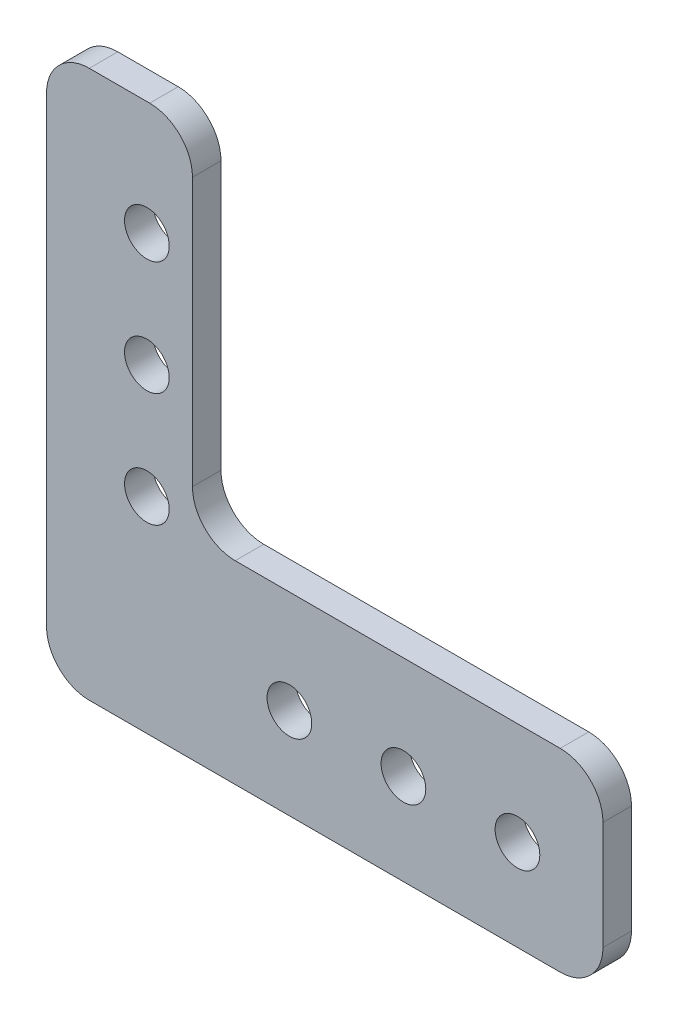
from build123d import *

# Parameters (mm, degrees)
SKETCH1_R           = 2.4892
BOSS_EXTRUDE1_DEPTH = 3.175
FILLET1_R           = 4.7625


with BuildPart() as part:
    # Sketch1 → Boss-Extrude1 (new body)
    with BuildSketch(Plane.XY):
        Polygon((-27.051, 31.75), (-27.051, -29.21), (34.925, -29.21), (34.925, -7.62), (-10.795, -7.62), (-10.795, 31.75), align=None)
        with Locations((-15.875, -6.35)):
            Circle(SKETCH1_R, mode=Mode.SUBTRACT)
        with Locations((0, -19.05)):
            Circle(SKETCH1_R, mode=Mode.SUBTRACT)
        with Locations((12.7, -19.05)):
            Circle(SKETCH1_R, mode=Mode.SUBTRACT)
        with Locations((25.4, -19.05)):
            Circle(SKETCH1_R, mode=Mode.SUBTRACT)
        with Locations((-15.875, 6.35)):
            Circle(SKETCH1_R, mode=Mode.SUBTRACT)
        with Locations((-15.875, 19.05)):
            Circle(SKETCH1_R, mode=Mode.SUBTRACT)
    extrude(amount=BOSS_EXTRUDE1_DEPTH)

    # Fillet1
    fillet1_edges = [part.edges().sort_by_distance(p)[0] for p in [
        (-27.051, 31.75, 1.5875),
        (-10.795, 31.75, 1.5875),
        (-10.795, -7.62, 1.5875),
        (34.925, -7.62, 1.5875),
        (34.925, -29.21, 1.5875),
        (-27.051, -29.21, 1.5875),
    ]]
    fillet(fillet1_edges, radius=FILLET1_R)


solid = part.part
